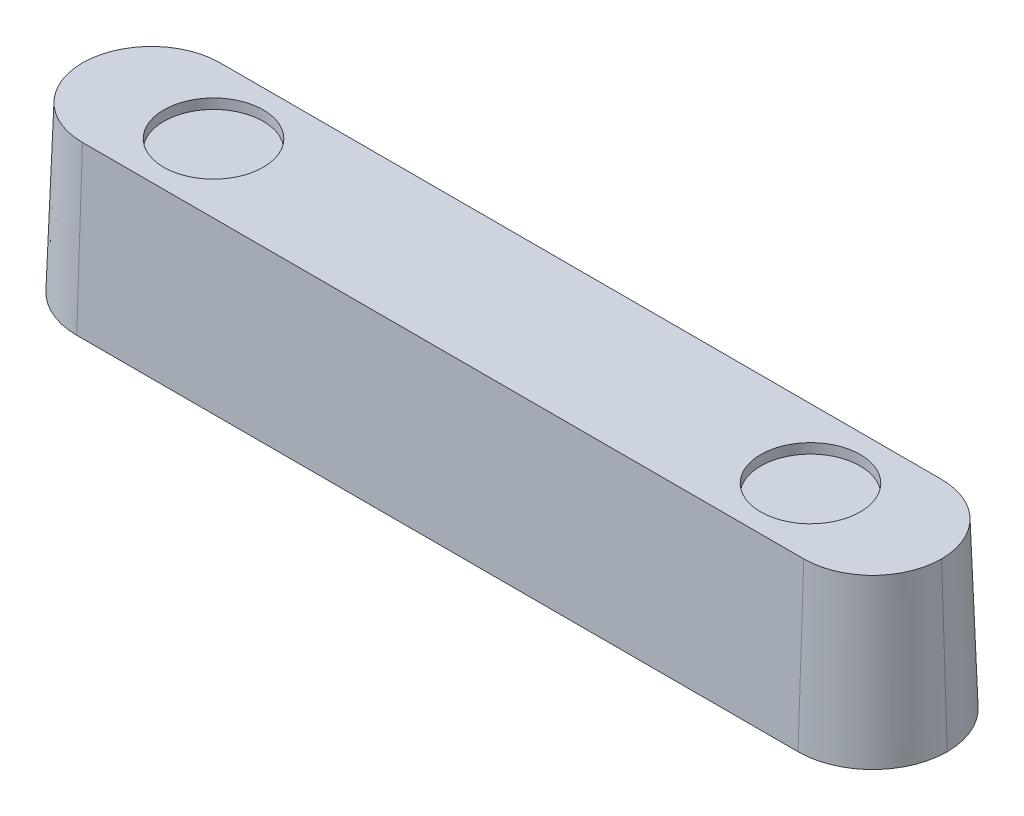
from build123d import *

# Parameters (mm, degrees)
SKETCH1_W           = 175
SKETCH1_H           = 30
BOSS_EXTRUDE1_DEPTH = 33
SKETCH3_R           = 10
CUT_EXTRUDE1_DEPTH  = 2
FILLET1_R           = 15
SKETCH4_R           = 4
CUT_EXTRUDE2_DEPTH  = 4
DRAFT3_ANGLE        = -2


with BuildPart() as part:
    # Sketch1 → Boss-Extrude1 (new body)
    with BuildSketch(Plane(origin=(0, 0, 0), x_dir=(1, 0, 0), z_dir=(0, 1, 0))):
        Rectangle(SKETCH1_W, SKETCH1_H)
    extrude(amount=BOSS_EXTRUDE1_DEPTH)

    # Sketch3 → Cut-Extrude1 (cut)
    with BuildSketch(Plane(origin=(0, 33, 0), x_dir=(1, 0, 0), z_dir=(0, 1, 0))):
        with Locations(Location((-60, 0, 0), (0, 0, 270))):
            Circle(SKETCH3_R)
        with Locations(Location((60, 0, 0), (0, 0, 270))):
            Circle(SKETCH3_R)
    extrude(amount=-CUT_EXTRUDE1_DEPTH, mode=Mode.SUBTRACT)

    # Fillet1
    fillet1_edges = [part.edges().sort_by_distance(p)[0] for p in [
        (-87.5, 16.5, -15),
        (87.5, 16.5, 15),
        (87.5, 16.5, -15),
        (-87.5, 16.5, 15),
    ]]
    fillet(fillet1_edges, radius=FILLET1_R - 0.0001)  # a hair under: the kernel refuses the full size

    # Sketch4 → Cut-Extrude2 (cut)
    with BuildSketch(Plane(origin=(0, 0, -15), x_dir=(-1, 0, 0), z_dir=(0, 0, -1))):
        with Locations((0, 17.1)):
            Circle(SKETCH4_R)
    extrude(amount=-CUT_EXTRUDE2_DEPTH, mode=Mode.SUBTRACT)

    # Draft3
    draft3_faces = [part.faces().sort_by_distance(p)[0] for p in [
        (0, 16.5, 15),
        (83.106631007, 16.5, 10.606631007),
        (83.106631007, 16.5, -10.606631007),
        (0, 1.487079621, -15),
        (-83.106631007, 16.5, 10.606631007),
        (-83.106631007, 16.5, -10.606631007),
    ]]
    draft(draft3_faces, Plane(origin=(0, 0, 0), x_dir=(0, 0, -1), z_dir=(0, -1, 0)), DRAFT3_ANGLE)


solid = part.part
